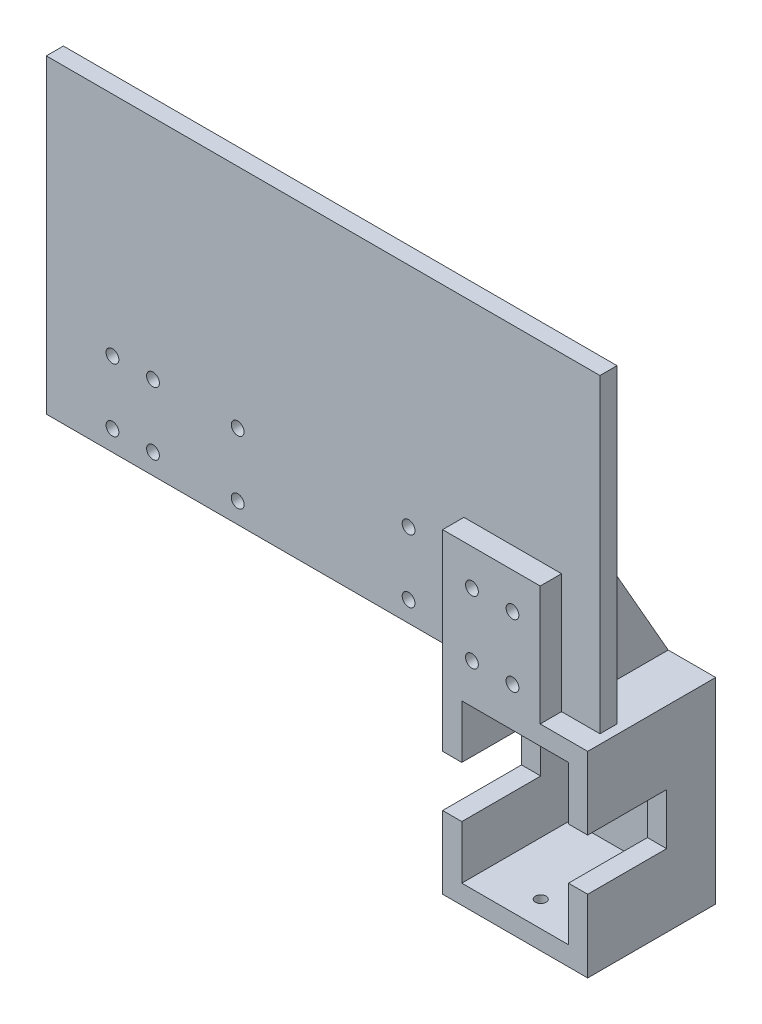
from build123d import *

# Parameters (mm, degrees)
BOSS_EXTRUDE1_START     = -4
BOSS_EXTRUDE1_OUTLINE_W = 129.75
BOSS_EXTRUDE1_OUTLINE_H = 72.722660418
BOSS_EXTRUDE1_OUTLINE_R = 1.5
BOSS_EXTRUDE1_DEPTH     = 4
THICKEN1_START          = -1.998922973
THICKEN1_DEPTH          = 46
THICKEN1_START_2        = 39.501077027
THICKEN1_2_DEPTH        = 4.5
THICKEN1_3_OUTLINE_R    = 1.25
THICKEN1_3_DEPTH        = 4.5
THICKEN1_START_3        = 2.501077027
THICKEN1_4_OUTLINE_W    = 4.5
THICKEN1_4_OUTLINE_H    = 18.5
THICKEN1_4_DEPTH        = 12.5
THICKEN1_START_4        = 27.001077027
THICKEN1_5_OUTLINE_W    = 4.5
THICKEN1_5_OUTLINE_H    = 18.5
THICKEN1_5_DEPTH        = 12.5
BOSS_EXTRUDE2_START     = 5
SKETCH5_W               = 22.875
SKETCH5_H               = 28
SKETCH5_R               = 1.5
BOSS_EXTRUDE2_DEPTH     = 5
SKETCH6_W               = 22.875
SKETCH6_H               = 28
SKETCH6_R               = 1.5
BOSS_EXTRUDE3_DEPTH     = 4.5
THICKEN2_T2             = 2
THICKEN3_T2             = 2


# Read off the part's stored shape, not the designer's step: Boss-Extrude1, Thicken1
with BuildPart() as part:
    # Boss-Extrude1 outline → Boss-Extrude1 (new body)
    with BuildSketch(Plane(origin=(0, 0, -228), x_dir=(-1, 0, 0), z_dir=(0, 0, -1)).offset(BOSS_EXTRUDE1_START)):
        with Locations((-64.999085346, 80.362407236)):
            Rectangle(BOSS_EXTRUDE1_OUTLINE_W, BOSS_EXTRUDE1_OUTLINE_H)
        with Locations((-114.374085346, 48.801077027)):
            Circle(BOSS_EXTRUDE1_OUTLINE_R, mode=Mode.SUBTRACT)
        with Locations((-104.874085346, 48.801077027)):
            Circle(BOSS_EXTRUDE1_OUTLINE_R, mode=Mode.SUBTRACT)
        with Locations((-85.024085346, 48.801077027)):
            Circle(BOSS_EXTRUDE1_OUTLINE_R, mode=Mode.SUBTRACT)
        with Locations((-114.374085346, 63.551077027)):
            Circle(BOSS_EXTRUDE1_OUTLINE_R, mode=Mode.SUBTRACT)
        with Locations((-104.874085346, 63.551077027)):
            Circle(BOSS_EXTRUDE1_OUTLINE_R, mode=Mode.SUBTRACT)
        with Locations((-85.024085346, 63.551077027)):
            Circle(BOSS_EXTRUDE1_OUTLINE_R, mode=Mode.SUBTRACT)
        with Locations((-44.974085346, 48.801077027)):
            Circle(BOSS_EXTRUDE1_OUTLINE_R, mode=Mode.SUBTRACT)
        with Locations((-25.124085346, 48.801077027)):
            Circle(BOSS_EXTRUDE1_OUTLINE_R, mode=Mode.SUBTRACT)
        with Locations((-15.624085346, 48.801077027)):
            Circle(BOSS_EXTRUDE1_OUTLINE_R, mode=Mode.SUBTRACT)
        with Locations((-44.974085346, 63.551077027)):
            Circle(BOSS_EXTRUDE1_OUTLINE_R, mode=Mode.SUBTRACT)
        with Locations((-25.124085346, 63.551077027)):
            Circle(BOSS_EXTRUDE1_OUTLINE_R, mode=Mode.SUBTRACT)
        with Locations((-15.624085346, 63.551077027)):
            Circle(BOSS_EXTRUDE1_OUTLINE_R, mode=Mode.SUBTRACT)
    extrude(amount=BOSS_EXTRUDE1_DEPTH)


with BuildPart() as body_2:
    # Thicken1 outline → Thicken1 (new body)
    with BuildSketch(Plane(origin=(0, 0, 0), x_dir=(1, 0, 0), z_dir=(0, 1, 0)).offset(THICKEN1_START)):
        Polygon((97.999085346, 237.5), (102.499085346, 237.5), (102.499085346, 244.5), (127.499085346, 244.5), (127.499085346, 237.5), (131.999085346, 237.5), (131.999085346, 249), (97.999085346, 249), align=None)
    extrude(amount=THICKEN1_DEPTH)

    # Thicken1 2 outline → Thicken1 2 (add)
    with BuildSketch(Plane(origin=(0, 0, 0), x_dir=(1, 0, 0), z_dir=(0, 1, 0)).offset(THICKEN1_START_2)):
        Polygon((97.999085346, 219), (131.999085346, 219), (131.999085346, 237.5), (127.499085346, 237.5), (127.499085346, 244.5), (102.499085346, 244.5), (102.499085346, 237.5), (97.999085346, 237.5), align=None)
    extrude(amount=THICKEN1_2_DEPTH)

    # Thicken1 3 outline → Thicken1 3 (add)
    with BuildSketch(Plane(origin=(0, 0, 0), x_dir=(1, 0, 0), z_dir=(0, 1, 0)).offset(THICKEN1_START)):
        Polygon((97.999085346, 219), (131.999085346, 219), (131.999085346, 237.5), (127.499085346, 237.5), (127.499085346, 244.5), (102.499085346, 244.5), (102.499085346, 237.5), (97.999085346, 237.5), align=None)
        with Locations((114.999085346, 225)):
            Circle(THICKEN1_3_OUTLINE_R, mode=Mode.SUBTRACT)
    extrude(amount=THICKEN1_3_DEPTH)

    # Thicken1 4 outline → Thicken1 4 (add)
    with BuildSketch(Plane(origin=(0, 0, 0), x_dir=(1, 0, 0), z_dir=(0, 1, 0)).offset(THICKEN1_START_3)):
        with Locations((100.249085346, 228.25)):
            Rectangle(THICKEN1_4_OUTLINE_W, THICKEN1_4_OUTLINE_H)
        with Locations((129.749085346, 228.25)):
            Rectangle(THICKEN1_4_OUTLINE_W, THICKEN1_4_OUTLINE_H)
    extrude(amount=THICKEN1_4_DEPTH)

    # Thicken1 5 outline → Thicken1 5 (add)
    with BuildSketch(Plane(origin=(0, 0, 0), x_dir=(1, 0, 0), z_dir=(0, 1, 0)).offset(THICKEN1_START_4)):
        with Locations((100.249085346, 228.25)):
            Rectangle(THICKEN1_5_OUTLINE_W, THICKEN1_5_OUTLINE_H)
        with Locations((129.749085346, 228.25)):
            Rectangle(THICKEN1_5_OUTLINE_W, THICKEN1_5_OUTLINE_H)
    extrude(amount=THICKEN1_5_DEPTH)

    # Sketch5 → Boss-Extrude2 (add)
    with BuildSketch(Plane.XY.offset(-224).offset(BOSS_EXTRUDE2_START)):
        with Locations((109.436585346, 58.001077027)):
            Rectangle(SKETCH5_W, SKETCH5_H)
        with Locations((114.374085346, 48.801077027)):
            Circle(SKETCH5_R, mode=Mode.SUBTRACT)
        with Locations((104.874085346, 48.801077027)):
            Circle(SKETCH5_R, mode=Mode.SUBTRACT)
        with Locations((104.874085346, 63.551077027)):
            Circle(SKETCH5_R, mode=Mode.SUBTRACT)
        with Locations((114.374085346, 63.551077027)):
            Circle(SKETCH5_R, mode=Mode.SUBTRACT)
    extrude(amount=-BOSS_EXTRUDE2_DEPTH)

    # Sketch6 → Boss-Extrude3 (add)
    with BuildSketch(Plane(origin=(0, 0, -228.5), x_dir=(-1, 0, 0), z_dir=(0, 0, -1))):
        with Locations((-109.436585346, 58.001077027)):
            Rectangle(SKETCH6_W, SKETCH6_H)
        with Locations(Location((-114.374085346, 48.801077027, 0), (0, 0, 180))):
            Circle(SKETCH6_R, mode=Mode.SUBTRACT)
        with Locations(Location((-104.874085346, 48.801077027, 0), (0, 0, 180))):
            Circle(SKETCH6_R, mode=Mode.SUBTRACT)
        with Locations(Location((-104.874085346, 63.551077027, 0), (0, 0, 180))):
            Circle(SKETCH6_R, mode=Mode.SUBTRACT)
        with Locations(Location((-114.374085346, 63.551077027, 0), (0, 0, 180))):
            Circle(SKETCH6_R, mode=Mode.SUBTRACT)
    extrude(amount=BOSS_EXTRUDE3_DEPTH)

    # Sketch8 → Surface-Plane5: a flat surface bounded by the sketch
    with BuildSketch(Plane(origin=(120.874085346, 0, 0), x_dir=(0, 0, -1), z_dir=(1, 0, 0)), mode=Mode.PRIVATE) as surface_plane5_1_region:
        Polygon((233, 72.001077027), (249, 44.001077027), (233, 44.001077027), align=None)
    surface_plane5_1 = surface_plane5_1_region.sketch.faces()[0]
    add(Solid.thicken(surface_plane5_1, -THICKEN2_T2))

    # Sketch9 → Surface-Plane6: a flat surface bounded by the sketch
    with BuildSketch(Plane.ZY.offset(-97.999085346), mode=Mode.PRIVATE) as surface_plane6_2_region:
        Polygon((-249, 44.001077027), (-233, 44.001077027), (-233, 72.001077027), align=None)
    surface_plane6_2 = surface_plane6_2_region.sketch.faces()[0]
    add(Solid.thicken(surface_plane6_2, -THICKEN3_T2))


solid = Compound([part.part, body_2.part])
